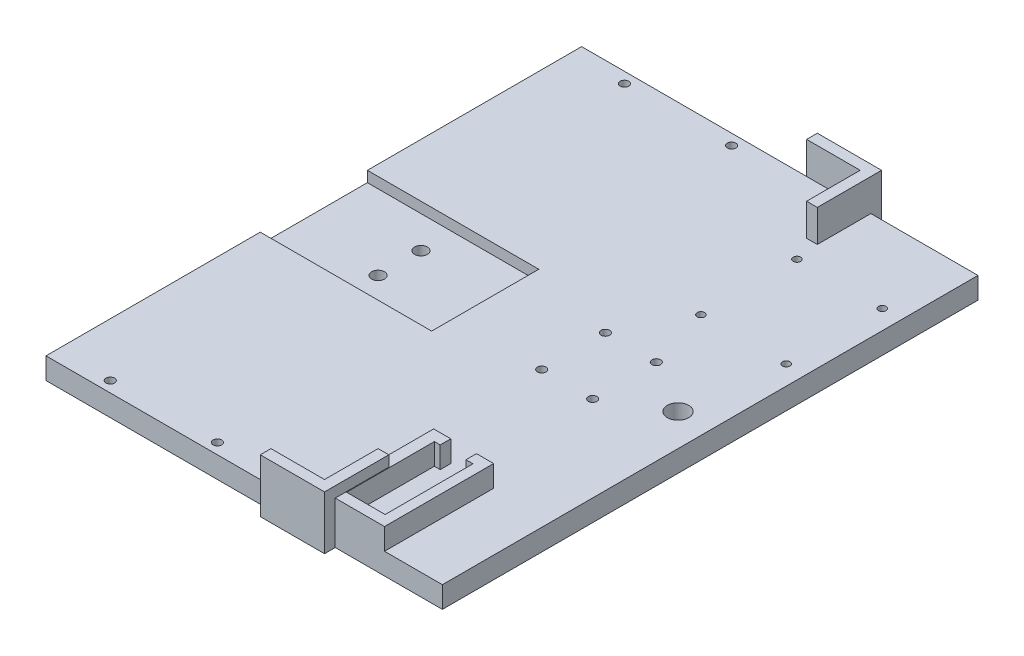
from build123d import *
from OCP.BRepFilletAPI import BRepFilletAPI_MakeChamfer

# Parameters (mm, degrees)
AUFSATZ_LINEAR_AUSTRAGEN1_DEPTH       = 15
SKIZZE2_W                             = 5
SKIZZE2_H                             = 4
SKIZZE2_H_2                           = 3
AUFSATZ_LINEAR_AUSTRAGEN2_DEPTH       = 37
AUFSATZ_LINEAR_AUSTRAGEN3_DEPTH       = 15
SKIZZE4_W                             = 5
SKIZZE4_H                             = 250
AUFSATZ_LINEAR_AUSTRAGEN4_DEPTH       = 15
SKIZZE5_W                             = 30
SKIZZE5_H                             = 5
AUFSATZ_LINEAR_AUSTRAGEN5_DEPTH       = 30
AUFSATZ_LINEAR_AUSTRAGEN6_DEPTH       = 15
AUFSATZ_LINEAR_AUSTRAGEN6_2_DEPTH     = 15
SKIZZE7_W                             = 5
SKIZZE7_H                             = 5
AUFSATZ_LINEAR_AUSTRAGEN7_DEPTH       = 15
AUFSATZ_LINEAR_AUSTRAGEN8_DEPTH       = 15
AUFSATZ_LINEAR_AUSTRAGEN8_DEPTH_BACK  = 15
SKIZZE8_W                             = 5
SKIZZE8_H                             = 30.74644599
SKIZZE8_H_2                           = 29.008771532
SKIZZE9_W                             = 5
SKIZZE9_H                             = 5
AUFSATZ_LINEAR_AUSTRAGEN10_DEPTH      = 15
SKIZZE10_W                            = 5
SKIZZE10_H                            = 30
SCHNITT_LINEAR_AUSTRAGEN1_DEPTH       = 1.01
SKIZZE12_W                            = 10.711230156
SKIZZE12_H                            = 5
SKIZZE12_W_2                          = 5
SKIZZE12_H_2                          = 5.74644599
SKIZZE12_H_3                          = 4.008771532
SKIZZE12_W_3                          = 18.406645612
SKIZZE12_H_4                          = 11.130363441
SKIZZE12_W_4                          = 9.588104439
SKIZZE12_H_5                          = 13.193622238
SCHNITT_LINEAR_AUSTRAGEN2_DEPTH       = 15
SKIZZE13_W                            = 10.711230156
SKIZZE13_H                            = 5
SKIZZE13_W_2                          = 9.588104439
SKIZZE13_W_3                          = 5
SKIZZE13_H_2                          = 13.193622238
SKIZZE13_H_3                          = 11.130363441
SKIZZE13_W_4                          = 18.406645612
SCHNITT_LINEAR_AUSTRAGEN3_DEPTH       = 15
SKIZZE14_W                            = 50
SKIZZE14_H                            = 50
SKIZZE14_W_2                          = 20
AUFSATZ_LINEAR_AUSTRAGEN11_DEPTH      = 20
FASE2_SIZE                            = 20
FASE2_SIZE2                           = 50
FASE3_SIZE                            = 20
FASE3_SIZE2                           = 35
FASE4_SIZE                            = 20
SKIZZE15_R                            = 10
SKIZZE15_R_2                          = 7.5
AUFSATZ_LINEAR_AUSTRAGEN12_DEPTH      = 3
VERRUNDUNG1_R                         = 10
SKIZZE18_R                            = 10
SKIZZE18_R_2                          = 7.5
AUFSATZ_LINEAR_AUSTRAGEN13_DEPTH      = 3
VERRUNDUNG2_R                         = 10
SKIZZE19_R                            = 10
AUFSATZ_LINEAR_AUSTRAGEN14_DEPTH      = 3
VERRUNDUNG3_R                         = 10
SKIZZE20_R                            = 1.5
SCHNITT_LINEAR_AUSTRAGEN4_DEPTH       = 250
SKIZZE21_W                            = 4
SKIZZE21_H                            = 7
SKIZZE21_H_2                          = 5.2
SKIZZE21_W_2                          = 41
AUFSATZ_LINEAR_AUSTRAGEN15_DEPTH      = 10
SKIZZE22_R                            = 1.75
SCHNITT_LINEAR_AUSTRAGEN5_DEPTH       = 20
SCHNITT_LINEAR_AUSTRAGEN6_DEPTH       = 59
SCHNITT_LINEAR_AUSTRAGEN6_DEPTH_BACK  = 47
SKIZZE23_W                            = 190
SKIZZE23_H                            = 302.641157469
SKIZZE24_W                            = 50
SKIZZE24_H                            = 5
SCHNITT_LINEAR_AUSTRAGEN7_DEPTH       = 80
SKIZZE25_R                            = 12.5
SCHNITT_LINEAR_AUSTRAGEN8_DEPTH       = 80
SKIZZE26_R                            = 17.590862423
AUFSATZ_LINEAR_AUSTRAGEN16_DEPTH      = 10
SKIZZE27_R                            = 3
SCHNITT_LINEAR_AUSTRAGEN10_DEPTH      = 93
SKIZZE28_R                            = 2
SCHNITT_LINEAR_AUSTRAGEN11_DEPTH      = 93
SKIZZE29_R                            = 2
SCHNITT_LINEAR_AUSTRAGEN13_DEPTH      = 20
SKIZZE30_W                            = 80
SKIZZE30_H                            = 50
AUFSATZ_LINEAR_AUSTRAGEN17_DEPTH      = 7
SKIZZE31_R                            = 3
SCHNITT_LINEAR_AUSTRAGEN14_DEPTH      = 27
AUFSATZ_LINEAR_START                  = -9
SKIZZE32_R                            = 3
SKIZZE32_R_2                          = 3.723627145
SKIZZE32_R_3                          = 5.253378479
SKIZZE32_R_4                          = 5.58705402
AUFSATZ_LINEAR_AUSTRAGEN18_DEPTH      = 9
SKIZZE35_R                            = 1.75
SCHNITT_LINEAR_AUSTRAGEN16_DEPTH      = 20
SKIZZE36_R                            = 6.846616126
SKIZZE36_R_2                          = 4.471320942
SKIZZE36_R_3                          = 4.89424988
SKIZZE36_R_4                          = 3.525123697
AUFSATZ_LINEAR_AUSTRAGEN19_DEPTH      = 15
SKIZZE39_W                            = 50
SKIZZE39_H                            = 250
SCHNITT_LINEAR_AUSTRAGEN17_DEPTH      = 57
SKIZZE40_W                            = 11.456450468
SKIZZE40_H                            = 117.894868185
SCHNITT_LINEAR_AUSTRAGEN18_DEPTH      = 86
SKIZZE41_W                            = 5.359084078
SKIZZE41_H                            = 0.710531035
SCHNITT_LINEAR_AUSTRAGEN19_DEPTH      = 69
AUFSATZ_LINEAR_AUSTRAGEN20_DEPTH      = 10
SCHNITT_LINEAR_AUSTRAGEN20_DEPTH      = 48
SCHNITT_LINEAR_AUSTRAGEN20_DEPTH_BACK = 345
SKIZZE44_W                            = 185
SKIZZE44_H                            = 5
SKIZZE45_R                            = 5
SCHNITT_LINEAR_AUSTRAGEN21_DEPTH      = 10


with BuildPart() as part:
    # Skizze1 → Aufsatz-Linear austragen1 (new body)
    with BuildSketch(Plane(origin=(0, 0, 0), x_dir=(1, 0, 0), z_dir=(0, 1, 0))):
        Polygon((-105, 65), (-175, 65), (-175, -65), (-105, -65), (-105, -125), (145, -125), (185, -20), (175, -20), (175, 0), (175, 20), (185, 20), (145, 125), (-105, 125), align=None)
        Polygon((175, 0), (175, 20), (185, 20), (185, 0), (185, -20), (175, -20), align=None)
    extrude(amount=AUFSATZ_LINEAR_AUSTRAGEN1_DEPTH)

    # Skizze2 → Aufsatz-Linear austragen2 (add)
    with BuildSketch(Plane(origin=(0, 15, 0), x_dir=(1, 0, 0), z_dir=(0, 1, 0))):
        with Locations((-122.5, -40)):
            Rectangle(SKIZZE2_W, SKIZZE2_H)
        with Locations((-122.5, 40)):
            Rectangle(SKIZZE2_W, SKIZZE2_H)
        with Locations((-122.5, 63.5)):
            Rectangle(SKIZZE2_W, SKIZZE2_H_2)
        with Locations((-122.5, -63.5)):
            Rectangle(SKIZZE2_W, SKIZZE2_H_2)
    extrude(amount=-AUFSATZ_LINEAR_AUSTRAGEN2_DEPTH)

    # Skizze3 → Aufsatz-Linear austragen3 (add)
    with BuildSketch(Plane(origin=(0, 15, 0), x_dir=(1, 0, 0), z_dir=(0, 1, 0))):
        Polygon((145, -125), (195, -125), (195, 125), (145, 125), (185, 20), (185, -20), align=None)
    extrude(amount=-AUFSATZ_LINEAR_AUSTRAGEN3_DEPTH)

    # Skizze4 → Aufsatz-Linear austragen4 (add)
    with BuildSketch(Plane(origin=(0, 15, 0), x_dir=(1, 0, 0), z_dir=(0, 1, 0))):
        with Locations((197.5, 0)):
            Rectangle(SKIZZE4_W, SKIZZE4_H)
    extrude(amount=-AUFSATZ_LINEAR_AUSTRAGEN4_DEPTH)

    # Skizze5 → Aufsatz-Linear austragen5 (add)
    with BuildSketch(Plane(origin=(0, 15, 0), x_dir=(1, 0, 0), z_dir=(0, 1, 0))):
        with Locations((-90, 122.5)):
            Rectangle(SKIZZE5_W, SKIZZE5_H)
        with Locations((-90, -122.5)):
            Rectangle(SKIZZE5_W, SKIZZE5_H)
    extrude(amount=-AUFSATZ_LINEAR_AUSTRAGEN5_DEPTH)



with BuildPart() as body_2:
    # Skizze6 → Aufsatz-Linear austragen6 (new body)
    with BuildSketch(Plane(origin=(0, 15, 0), x_dir=(1, 0, 0), z_dir=(0, 1, 0))):
        Polygon((-61.593354388, 130), (-110, 130), (-110, 88.869636559), (-105, 88.869636559), (-105, 125), (-61.593354388, 125), align=None)
    extrude(amount=AUFSATZ_LINEAR_AUSTRAGEN6_DEPTH)


with BuildPart() as body_3:
    # Skizze6 → Aufsatz-Linear austragen6 2 (new body)
    with BuildSketch(Plane(origin=(0, 15, 0), x_dir=(1, 0, 0), z_dir=(0, 1, 0))):
        Polygon((-110, -86.806377762), (-110, -130), (-70.411895561, -130), (-70.411895561, -125), (-105, -125), (-105, -86.806377762), align=None)
    extrude(amount=AUFSATZ_LINEAR_AUSTRAGEN6_2_DEPTH)


with BuildPart() as part_1:
    add(part.part)

    add(body_2.part)  # Aufsatz-Linear austragen7 merges body 2

    add(body_3.part)  # Aufsatz-Linear austragen7 merges body 3
    # Skizze7 → Aufsatz-Linear austragen7 (add)
    with BuildSketch(Plane.XZ):
        Polygon((-110, -88.869636559), (-110, -125), (-105, -125), (-105, -120), (-105, -88.869636559), align=None)
        with Locations((-107.5, -127.5)):
            Rectangle(SKIZZE7_W, SKIZZE7_H)
        Polygon((-105, -125), (-105, -130), (-61.593354388, -130), (-61.593354388, -125), (-75, -125), align=None)
        Polygon((-105, 125), (-110, 125), (-110, 86.806377762), (-105, 86.806377762), (-105, 120), align=None)
        with Locations((-107.5, 127.5)):
            Rectangle(SKIZZE7_W, SKIZZE7_H)
        Polygon((-70.411895561, 130), (-105, 130), (-105, 125), (-75, 125), (-70.411895561, 125), align=None)
    extrude(amount=-AUFSATZ_LINEAR_AUSTRAGEN7_DEPTH)

    # Skizze8 → Aufsatz-Linear austragen8 (add, two sides: drawn at the far end of the back side and taken through both)
    with BuildSketch(Plane(origin=(0, 15, 0), x_dir=(1, 0, 0), z_dir=(0, 1, 0)).offset(-AUFSATZ_LINEAR_AUSTRAGEN8_DEPTH_BACK)):
        with Locations((147.5, -109.626777005)):
            Rectangle(SKIZZE8_W, SKIZZE8_H)
        Polygon((145, -125), (109.288769844, -125), (109.288769844, -130), (150, -130), (150, -125), align=None)
        with Locations((147.5, 110.495614234)):
            Rectangle(SKIZZE8_W, SKIZZE8_H_2)
        Polygon((118.994620346, 130), (118.994620346, 125), (145, 125), (150, 125), (150, 130), align=None)
    extrude(amount=AUFSATZ_LINEAR_AUSTRAGEN8_DEPTH + AUFSATZ_LINEAR_AUSTRAGEN8_DEPTH_BACK)

    # Skizze9 → Aufsatz-Linear austragen10 (add)
    with BuildSketch(Plane(origin=(0, 15, 0), x_dir=(1, 0, 0), z_dir=(0, 1, 0))):
        Polygon((145, 4), (150, 4), (150, 9), (150, 14), (145, 14), align=None)
        with Locations((152.5, 6.5)):
            Rectangle(SKIZZE9_W, SKIZZE9_H)
        Polygon((190, 4), (200, 4), (200, 14), (196, 14), (196, 9), (190, 9), align=None)
        Polygon((196, 105), (200, 105), (200, 125), (150, 125), (150, 120), (196, 120), align=None)
    extrude(amount=AUFSATZ_LINEAR_AUSTRAGEN10_DEPTH)

    # Skizze10 → Schnitt-Linear austragen1 (cut)
    with BuildSketch(Plane.ZY.offset(-118.994620346)):
        with Locations((-127.5, 15)):
            Rectangle(SKIZZE10_W, SKIZZE10_H)
    extrude(amount=-SCHNITT_LINEAR_AUSTRAGEN1_DEPTH, mode=Mode.SUBTRACT)

    # Skizze12 → Schnitt-Linear austragen2 (cut)
    with BuildSketch(Plane(origin=(0, 15, 0), x_dir=(1, 0, 0), z_dir=(0, 1, 0))):
        with Locations((114.644384922, -127.5)):
            Rectangle(SKIZZE12_W, SKIZZE12_H)
        with Locations((147.5, -97.126777005)):
            Rectangle(SKIZZE12_W_2, SKIZZE12_H_2)
        with Locations((147.5, 97.995614234)):
            Rectangle(SKIZZE12_W_2, SKIZZE12_H_3)
        with Locations((-70.796677194, 127.5)):
            Rectangle(SKIZZE12_W_3, SKIZZE12_H)
        with Locations((-107.5, 94.43481828)):
            Rectangle(SKIZZE12_W_2, SKIZZE12_H_4)
        with Locations((-75.20594778, -127.5)):
            Rectangle(SKIZZE12_W_4, SKIZZE12_H)
        with Locations((-107.5, -93.403188881)):
            Rectangle(SKIZZE12_W_2, SKIZZE12_H_5)
    extrude(amount=SCHNITT_LINEAR_AUSTRAGEN2_DEPTH, mode=Mode.SUBTRACT)

    # Skizze13 → Schnitt-Linear austragen3 (cut)
    with BuildSketch(Plane(origin=(0, 15, 0), x_dir=(1, 0, 0), z_dir=(0, 1, 0))):
        with Locations((114.644384922, -127.5)):
            Rectangle(SKIZZE13_W, SKIZZE13_H)
        with Locations((-75.20594778, -127.5)):
            Rectangle(SKIZZE13_W_2, SKIZZE13_H)
        with Locations((-107.5, -93.403188881)):
            Rectangle(SKIZZE13_W_3, SKIZZE13_H_2)
        with Locations((-107.5, 94.43481828)):
            Rectangle(SKIZZE13_W_3, SKIZZE13_H_3)
        with Locations((-70.796677194, 127.5)):
            Rectangle(SKIZZE13_W_4, SKIZZE13_H)
    extrude(amount=-SCHNITT_LINEAR_AUSTRAGEN3_DEPTH, mode=Mode.SUBTRACT)

    # Skizze14 → Aufsatz-Linear austragen11 (add)
    with BuildSketch(Plane(origin=(0, 15, 0), x_dir=(1, 0, 0), z_dir=(0, 1, 0))):
        Polygon((-175, -25), (-175, -65), (-105, -65), (-105, -25), (-125, -25), align=None)
        with Locations((-150, 0)):
            Rectangle(SKIZZE14_W, SKIZZE14_H)
        with Locations((-115, 0)):
            Rectangle(SKIZZE14_W_2, SKIZZE14_H)
        Polygon((-175, 65), (-175, 25), (-125, 25), (-105, 25), (-105, 65), align=None)
    extrude(amount=AUFSATZ_LINEAR_AUSTRAGEN11_DEPTH)

    # Fase2
    fase2_edges = [part_1.edges().sort_by_distance(p)[0] for p in [
        (-175, 35, 0),
    ]]
    fase2_side = [part_1.faces().sort_by_distance(p)[0] for p in [
        (-175, 17.5, 0),
    ]]
    chamfer(fase2_edges, length=FASE2_SIZE, length2=FASE2_SIZE2, reference=fase2_side[0])

    # Fase3: one chamfer whose edges measure the first distance from different faces: ONE call of the kernel's chamfer builder (chamfer() names one face for all edges)
    fase3_edges_1 = [part_1.edges().sort_by_distance(p)[0] for p in [
        (-115, 35, -65),
    ]]
    fase3_side_1 = [part_1.faces().sort_by_distance(p)[0] for p in [
        (-134.615695793, 13.348705502, -65),
    ]]
    fase3_edges_2 = [part_1.edges().sort_by_distance(p)[0] for p in [
        (-115, 35, 65),
    ]]
    fase3_side_2 = [part_1.faces().sort_by_distance(p)[0] for p in [
        (-134.615695793, 13.348705502, 65),
    ]]
    fase3 = BRepFilletAPI_MakeChamfer(part_1.part.solid().wrapped)
    for e in fase3_edges_1:
        fase3.Add(FASE3_SIZE, FASE3_SIZE2, e.wrapped, fase3_side_1[0].wrapped)  # the first distance lies on this face
    for e in fase3_edges_2:
        fase3.Add(FASE3_SIZE, FASE3_SIZE2, e.wrapped, fase3_side_2[0].wrapped)  # the first distance lies on this face
    add(Compound.cast(fase3.Shape()), mode=Mode.REPLACE)

    # Fase4
    fase4_edges = [part_1.edges().sort_by_distance(p)[0] for p in [
        (-150, 25, 47.5),
        (-150, 25, -47.5),
    ]]
    chamfer(fase4_edges, length=FASE4_SIZE)

    # Skizze15 → Aufsatz-Linear austragen12 (add)
    with BuildSketch(Plane(origin=(-11.551963806, 55.886277719, -15.432210402), x_dir=(0.9807222582245502, 0.18835756766165584, -0.05201229592628623), z_dir=(-0.19540688888301463, 0.9453426139004438, -0.2610430809673718))):
        with Locations(Location((-117.284914164, 20.601047932, 0), (0, 0, 270))):
            Circle(SKIZZE15_R)
        with Locations(Location((-142.839757147, 36.315690789, 0), (0, 0, 270))):
            Circle(SKIZZE15_R_2)
    extrude(amount=AUFSATZ_LINEAR_AUSTRAGEN12_DEPTH)

    # Verrundung1
    # the kernel refuses this fillet: 10 mm, written as the material it takes off along each edge
    with BuildSketch(Plane(origin=(-127.162110348, 31.147334465, -29.972945243), x_dir=(0, 0.26617432079083353, 0.963924909394678), z_dir=(-0.9807222582245501, -0.18835756766165582, 0.052012295926286305))) as verrundung1_piece_1:
        with BuildLine():
            CenterArc((2.858571571, -10), VERRUNDUNG1_R, 44.427004001, 45.572995999)
            Line((2.858571571, 0), (2.858571571, 0.2))
            Line((2.858571571, 0.2), (10, 0.2))
            Line((10, 0.2), (10.2, 0))
            ThreePointArc((10.2, 0), (10.2, -1.5), (10.142828569, -2.86))
            Line((10.142828569, -2.86), (10, -3))
        make_face()
    revolve(axis=Axis((-127.162110348, 31.147334465, -29.972945243), (-0.19540688888301466, 0.9453426139004438, -0.2610430809673718)), mode=Mode.SUBTRACT)
    with BuildSketch(Plane(origin=(-152.224313666, 22.15105201, -43.791514879), x_dir=(0, 0.26617432079083364, 0.9639249093946781), z_dir=(-0.9807222582245503, -0.18835756766165584, 0.052012295926286325))) as verrundung1_piece_2:
        with BuildLine():
            CenterArc((0.358571571, -10), VERRUNDUNG1_R, 44.427004001, 45.572995999)
            Line((0.358571571, 0), (0.358571571, 0.2))
            Line((0.358571571, 0.2), (7.5, 0.2))
            Line((7.5, 0.2), (7.7, 0))
            ThreePointArc((7.7, 0), (7.7, -1.5), (7.642828569, -2.86))
            Line((7.642828569, -2.86), (7.5, -3))
        make_face()
    revolve(axis=Axis((-152.224313666, 22.15105201, -43.791514879), (-0.19540688888301466, 0.9453426139004438, -0.2610430809673718)), mode=Mode.SUBTRACT)

    # Skizze18 → Aufsatz-Linear austragen13 (add)
    with BuildSketch(Plane(origin=(-11.551963806, 55.886277719, 15.432210402), x_dir=(0.9807222582245502, 0.18835756766165587, 0.05201229592628629), z_dir=(-0.19540688888301466, 0.9453426139004437, 0.261043080967372))):
        with Locations(Location((-117.284914164, -25.97894302, 0), (0, 0, 270))):
            Circle(SKIZZE18_R)
        with Locations(Location((-147.284914164, -39.72137923, 0), (0, 0, 270))):
            Circle(SKIZZE18_R_2)
    extrude(amount=AUFSATZ_LINEAR_AUSTRAGEN13_DEPTH)

    # Verrundung2
    # the kernel refuses this fillet: 10 mm, written as the material it takes off along each edge
    with BuildSketch(Plane(origin=(-127.162110348, 29.715876892, 35.156832279), x_dir=(0, -0.26617432079083353, 0.963924909394678), z_dir=(-0.98072225822455, -0.1883575676616558, -0.0520122959262863))) as verrundung2_piece_1:
        with BuildLine():
            CenterArc((2.858571571, -10), VERRUNDUNG2_R, 44.427004001, 45.572995999)
            Line((2.858571571, 0), (2.858571571, 0.2))
            Line((2.858571571, 0.2), (10, 0.2))
            Line((10, 0.2), (10.2, 0))
            ThreePointArc((10.2, 0), (10.2, -1.5), (10.142828569, -2.86))
            Line((10.142828569, -2.86), (10, -3))
        make_face()
    revolve(axis=Axis((-127.162110348, 29.715876892, 35.156832279), (-0.19540688888301463, 0.9453426139004436, 0.26104308096737205)), mode=Mode.SUBTRACT)
    with BuildSketch(Plane(origin=(-156.583778094, 20.407266239, 46.843139979), x_dir=(0, -0.26617432079083425, 0.9639249093946779), z_dir=(-0.9807222582245501, -0.18835756766165576, -0.05201229592628644))) as verrundung2_piece_2:
        with BuildLine():
            CenterArc((0.358571571, -10), VERRUNDUNG2_R, 44.427004001, 45.572995999)
            Line((0.358571571, 0), (0.358571571, 0.2))
            Line((0.358571571, 0.2), (7.5, 0.2))
            Line((7.5, 0.2), (7.7, 0))
            ThreePointArc((7.7, 0), (7.7, -1.5), (7.642828569, -2.86))
            Line((7.642828569, -2.86), (7.5, -3))
        make_face()
    revolve(axis=Axis((-156.583778094, 20.407266239, 46.843139979), (-0.19540688888301463, 0.9453426139004436, 0.26104308096737205)), mode=Mode.SUBTRACT)

    # Skizze19 → Aufsatz-Linear austragen14 (add)
    with BuildSketch(Plane(origin=(-29.310344828, 73.275862069, 0), x_dir=(0.9284766908852605, 0.371390676354101, 0), z_dir=(-0.371390676354101, 0.9284766908852605, 0))):
        with Locations(Location((-118.060912688, -0.063197478, 0), (0, 0, 180))):
            Circle(SKIZZE19_R)
        with Locations(Location((-139.860763151, 12.174715734, 0), (0, 0, 180))):
            Circle(SKIZZE19_R)
        with Locations(Location((-139.91256076, -12.208380744, 0), (0, 0, 180))):
            Circle(SKIZZE19_R)
    extrude(amount=AUFSATZ_LINEAR_AUSTRAGEN14_DEPTH)

    # Verrundung3
    # the kernel refuses this fillet: 10 mm, written as the material it takes off along each edge
    with BuildSketch(Plane(origin=(-140.041322392, 32.214569927, 0.063197478), x_dir=(-0.9284766908852606, -0.37139067635410067, 0), z_dir=(0, 0, -1))) as verrundung3_piece_1:
        with BuildLine():
            CenterArc((2.858571571, -10), VERRUNDUNG3_R, 44.427004001, 45.572995999)
            Line((2.858571571, 0), (2.858571571, 0.2))
            Line((2.858571571, 0.2), (10, 0.2))
            Line((10, 0.2), (10.2, 0))
            ThreePointArc((10.2, 0), (10.2, -1.5), (10.142828569, -2.86))
            Line((10.142828569, -2.86), (10, -3))
        make_face()
    revolve(axis=Axis((-140.041322392, 32.214569927, 0.063197478), (-0.371390676354101, 0.9284766908852605, 0)), mode=Mode.SUBTRACT)
    with BuildSketch(Plane(origin=(-160.281975412, 24.11830872, -12.174715734), x_dir=(-0.9284766908852602, -0.37139067635410167, 0), z_dir=(0, 0, -1))) as verrundung3_piece_2:
        with BuildLine():
            CenterArc((2.858571571, -10), VERRUNDUNG3_R, 44.427004001, 45.572995999)
            Line((2.858571571, 0), (2.858571571, 0.2))
            Line((2.858571571, 0.2), (10, 0.2))
            Line((10, 0.2), (10.2, 0))
            ThreePointArc((10.2, 0), (10.2, -1.5), (10.142828569, -2.86))
            Line((10.142828569, -2.86), (10, -3))
        make_face()
    revolve(axis=Axis((-160.281975412, 24.11830872, -12.174715734), (-0.371390676354101, 0.9284766908852605, 0)), mode=Mode.SUBTRACT)
    with BuildSketch(Plane(origin=(-160.330068284, 24.099071571, 12.208380744), x_dir=(-0.9284766908852602, -0.37139067635410167, 0), z_dir=(0, 0, -1))) as verrundung3_piece_3:
        with BuildLine():
            CenterArc((2.858571571, -10), VERRUNDUNG3_R, 44.427004001, 45.572995999)
            Line((2.858571571, 0), (2.858571571, 0.2))
            Line((2.858571571, 0.2), (10, 0.2))
            Line((10, 0.2), (10.2, 0))
            ThreePointArc((10.2, 0), (10.2, -1.5), (10.142828569, -2.86))
            Line((10.142828569, -2.86), (10, -3))
        make_face()
    revolve(axis=Axis((-160.330068284, 24.099071571, 12.208380744), (-0.371390676354101, 0.9284766908852605, 0)), mode=Mode.SUBTRACT)

    # Skizze20 → Schnitt-Linear austragen4 (cut)
    with BuildSketch(Plane(origin=(0, 0, -65), x_dir=(-1, 0, 0), z_dir=(0, 0, -1))):
        with Locations(Location((122.5, -19.5, 0), (0, 0, 180))):
            Circle(SKIZZE20_R)
        with Locations(Location((122.5, -2.5, 0), (0, 0, 180))):
            Circle(SKIZZE20_R)
    extrude(amount=-SCHNITT_LINEAR_AUSTRAGEN4_DEPTH, mode=Mode.SUBTRACT)

    # Skizze21 → Aufsatz-Linear austragen15 (add)
    with BuildSketch(Plane(origin=(0, 15, 0), x_dir=(1, 0, 0), z_dir=(0, 1, 0))):
        Polygon((145, -100), (150, -100), (191, -100), (191, -93), (145, -93), align=None)
        with Locations((193, -96.5)):
            Rectangle(SKIZZE21_W, SKIZZE21_H)
        with Locations((193, -102.6)):
            Rectangle(SKIZZE21_W, SKIZZE21_H_2)
        with Locations((170.5, -121.5)):
            Rectangle(SKIZZE21_W_2, SKIZZE21_H)
        with Locations((193, -121.5)):
            Rectangle(SKIZZE21_W, SKIZZE21_H)
        with Locations((193, -115.4)):
            Rectangle(SKIZZE21_W, SKIZZE21_H_2)
    extrude(amount=AUFSATZ_LINEAR_AUSTRAGEN15_DEPTH)

    # Skizze22 → Schnitt-Linear austragen5 (cut)
    with BuildSketch(Plane(origin=(0, 15, 0), x_dir=(1, 0, 0), z_dir=(0, 1, 0))):
        with Locations(Location((146.069548912, -58.232980191, 0), (0, 0, 270))):
            Circle(SKIZZE22_R)
        with Locations(Location((146.069548912, -13.432980191, 0), (0, 0, 270))):
            Circle(SKIZZE22_R)
        with Locations(Location((185.869548912, -58.232980191, 0), (0, 0, 270))):
            Circle(SKIZZE22_R)
        with Locations(Location((185.869548912, -13.432980191, 0), (0, 0, 270))):
            Circle(SKIZZE22_R)
    extrude(amount=-SCHNITT_LINEAR_AUSTRAGEN5_DEPTH, mode=Mode.SUBTRACT)

    # Skizze23 → Schnitt-Linear austragen6 (cut, two sides: drawn at the far end of the back side and taken through both)
    with BuildSketch(Plane(origin=(0, 15, 0), x_dir=(1, 0, 0), z_dir=(0, 1, 0)).offset(-SCHNITT_LINEAR_AUSTRAGEN6_DEPTH_BACK)):
        with Locations((-80, -1.728280721)):
            Rectangle(SKIZZE23_W, SKIZZE23_H)
    extrude(amount=SCHNITT_LINEAR_AUSTRAGEN6_DEPTH + SCHNITT_LINEAR_AUSTRAGEN6_DEPTH_BACK, mode=Mode.SUBTRACT)

    # Skizze24 → Schnitt-Linear austragen7 (cut)
    with BuildSketch(Plane.ZY.offset(-15)):
        with Locations((0, 12.5)):
            Rectangle(SKIZZE24_W, SKIZZE24_H)
    extrude(amount=-SCHNITT_LINEAR_AUSTRAGEN7_DEPTH, mode=Mode.SUBTRACT)

    # Skizze25 → Schnitt-Linear austragen8 (cut)
    with BuildSketch(Plane(origin=(0, 10, 0), x_dir=(1, 0, 0), z_dir=(0, 1, 0))):
        with Locations(Location((65, 0, 0), (0, 0, 270))):
            Circle(SKIZZE25_R)
    extrude(amount=-SCHNITT_LINEAR_AUSTRAGEN8_DEPTH, mode=Mode.SUBTRACT)

    # Skizze26 → Aufsatz-Linear austragen16 (add)
    with BuildSketch(Plane.XZ):
        with Locations((65, 0)):
            Circle(SKIZZE26_R)
    extrude(amount=-AUFSATZ_LINEAR_AUSTRAGEN16_DEPTH)

    # Skizze27 → Schnitt-Linear austragen10 (cut)
    with BuildSketch(Plane(origin=(0, 15, 0), x_dir=(1, 0, 0), z_dir=(0, 1, 0))):
        with Locations(Location((75, 10, 0), (0, 0, 270))):
            Circle(SKIZZE27_R)
        with Locations(Location((75, -10, 0), (0, 0, 270))):
            Circle(SKIZZE27_R)
        with Locations(Location((35, 10, 0), (0, 0, 270))):
            Circle(SKIZZE27_R)
        with Locations(Location((35, -10, 0), (0, 0, 270))):
            Circle(SKIZZE27_R)
    extrude(amount=-SCHNITT_LINEAR_AUSTRAGEN10_DEPTH, mode=Mode.SUBTRACT)

    # Skizze28 → Schnitt-Linear austragen11 (cut)
    with BuildSketch(Plane(origin=(0, 15, 0), x_dir=(1, 0, 0), z_dir=(0, 1, 0))):
        with Locations(Location((160, 14.85, 0), (0, 0, 270))):
            Circle(SKIZZE28_R)
        with Locations(Location((160, -14.85, 0), (0, 0, 270))):
            Circle(SKIZZE28_R)
        with Locations(Location((136.2, -14.85, 0), (0, 0, 270))):
            Circle(SKIZZE28_R)
        with Locations(Location((136.2, 14.85, 0), (0, 0, 270))):
            Circle(SKIZZE28_R)
    extrude(amount=-SCHNITT_LINEAR_AUSTRAGEN11_DEPTH, mode=Mode.SUBTRACT)

    # Skizze29 → Schnitt-Linear austragen13 (cut)
    with BuildSketch(Plane(origin=(0, 15, 0), x_dir=(1, 0, 0), z_dir=(0, 1, 0))):
        with Locations(Location((90, 120, 0), (0, 0, 270))):
            Circle(SKIZZE29_R)
        with Locations(Location((40, 120, 0), (0, 0, 270))):
            Circle(SKIZZE29_R)
        with Locations(Location((90, -120, 0), (0, 0, 270))):
            Circle(SKIZZE29_R)
        with Locations(Location((40, -120, 0), (0, 0, 270))):
            Circle(SKIZZE29_R)
    extrude(amount=-SCHNITT_LINEAR_AUSTRAGEN13_DEPTH, mode=Mode.SUBTRACT)

    # Skizze30 → Aufsatz-Linear austragen17 (add)
    with BuildSketch(Plane(origin=(0, 10, 0), x_dir=(1, 0, 0), z_dir=(0, 1, 0))):
        with Locations((55, 0)):
            Rectangle(SKIZZE30_W, SKIZZE30_H)
    extrude(amount=-AUFSATZ_LINEAR_AUSTRAGEN17_DEPTH)

    # Skizze31 → Schnitt-Linear austragen14 (cut)
    with BuildSketch(Plane(origin=(0, 10, 0), x_dir=(1, 0, 0), z_dir=(0, 1, 0))):
        with Locations(Location((55, 10, 0), (0, 0, 270))):
            Circle(SKIZZE31_R)
        with Locations(Location((55, -10, 0), (0, 0, 270))):
            Circle(SKIZZE31_R)
    extrude(amount=-SCHNITT_LINEAR_AUSTRAGEN14_DEPTH, mode=Mode.SUBTRACT)

    # Skizze32 → Aufsatz-Linear austragen18 (add)
    with BuildSketch(Plane.XZ.offset(AUFSATZ_LINEAR_START)):
        with Locations((75, -10)):
            Circle(SKIZZE32_R)
        with Locations((75, 10)):
            Circle(SKIZZE32_R_2)
        with Locations((35, 10)):
            Circle(SKIZZE32_R_3)
        with Locations((35, -10)):
            Circle(SKIZZE32_R_4)
    extrude(amount=AUFSATZ_LINEAR_AUSTRAGEN18_DEPTH)

    # Skizze35 → Schnitt-Linear austragen16 (cut)
    with BuildSketch(Plane(origin=(0, 15, 0), x_dir=(1, 0, 0), z_dir=(0, 1, 0))):
        with Locations(Location((151.210510648, 44.477580629, 0), (0, 0, 270))):
            Circle(SKIZZE35_R)
        with Locations(Location((191.010510648, 44.478487984, 0), (0, 0, 270))):
            Circle(SKIZZE35_R)
        with Locations(Location((151.210510648, 89.277580629, 0), (0, 0, 270))):
            Circle(SKIZZE35_R)
        with Locations(Location((191.010510648, 89.278487984, 0), (0, 0, 270))):
            Circle(SKIZZE35_R)
    extrude(amount=-SCHNITT_LINEAR_AUSTRAGEN16_DEPTH, mode=Mode.SUBTRACT)

    # Skizze36 → Aufsatz-Linear austragen19 (add)
    with BuildSketch(Plane(origin=(0, 15, 0), x_dir=(1, 0, 0), z_dir=(0, 1, 0))):
        with Locations((146.097099783, -61.909031942)):
            Circle(SKIZZE36_R)
        with Locations((186.685228416, -57.92608474)):
            Circle(SKIZZE36_R_2)
        with Locations((186.685228416, -12.786016446)):
            Circle(SKIZZE36_R_3)
        with Locations((146.097099783, -12.786016446)):
            Circle(SKIZZE36_R_4)
    extrude(amount=-AUFSATZ_LINEAR_AUSTRAGEN19_DEPTH)

    # Skizze39 → Schnitt-Linear austragen17 (cut)
    with BuildSketch(Plane(origin=(0, 15, 0), x_dir=(1, 0, 0), z_dir=(0, 1, 0))):
        with Locations((175, 0)):
            Rectangle(SKIZZE39_W, SKIZZE39_H)
    extrude(amount=SCHNITT_LINEAR_AUSTRAGEN17_DEPTH, mode=Mode.SUBTRACT)

    # Skizze40 → Schnitt-Linear austragen18 (cut)
    with BuildSketch(Plane(origin=(0, 15, 0), x_dir=(1, 0, 0), z_dir=(0, 1, 0))):
        with Locations((148.530078419, -40.830256609)):
            Rectangle(SKIZZE40_W, SKIZZE40_H)
    extrude(amount=SCHNITT_LINEAR_AUSTRAGEN18_DEPTH, mode=Mode.SUBTRACT)

    # Skizze41 → Schnitt-Linear austragen19 (cut)
    with BuildSketch(Plane(origin=(0, 15, 0), x_dir=(1, 0, 0), z_dir=(0, 1, 0))):
        with Locations((147.679542039, -99.644734483)):
            Rectangle(SKIZZE41_W, SKIZZE41_H)
    extrude(amount=SCHNITT_LINEAR_AUSTRAGEN19_DEPTH, mode=Mode.SUBTRACT)

    # Skizze42 → Aufsatz-Linear austragen20 (add)
    with BuildSketch(Plane(origin=(0, 15, 0), x_dir=(1, 0, 0), z_dir=(0, 1, 0))):
        Polygon((168.282600421, -120), (150.282600421, -120), (150.282600421, -79), (153, -79), (153, -74.066572639), (145, -74.066572639), (145, -100), (150, -100), (150, -125), (173, -125), (173, -74.066572639), (165, -74.066572639), (165, -79), (168.282600421, -79), align=None)
    extrude(amount=AUFSATZ_LINEAR_AUSTRAGEN20_DEPTH)

    # Skizze44 → Schnitt-Linear austragen20 (cut, two sides: drawn at the far end of the back side and taken through both)
    with BuildSketch(Plane(origin=(0, 0, -125), x_dir=(-1, 0, 0), z_dir=(0, 0, -1)).offset(-SCHNITT_LINEAR_AUSTRAGEN20_DEPTH_BACK)):
        with Locations((-107.5, 2.5)):
            Rectangle(SKIZZE44_W, SKIZZE44_H)
    extrude(amount=SCHNITT_LINEAR_AUSTRAGEN20_DEPTH + SCHNITT_LINEAR_AUSTRAGEN20_DEPTH_BACK, mode=Mode.SUBTRACT)

    # Skizze45 → Schnitt-Linear austragen21 (cut)
    with BuildSketch(Plane(origin=(0, 15, 0), x_dir=(1, 0, 0), z_dir=(0, 1, 0))):
        with Locations(Location((185, 0, 0), (0, 0, 270))):
            Circle(SKIZZE45_R)
    extrude(amount=-SCHNITT_LINEAR_AUSTRAGEN21_DEPTH, mode=Mode.SUBTRACT)


solid = part_1.part
